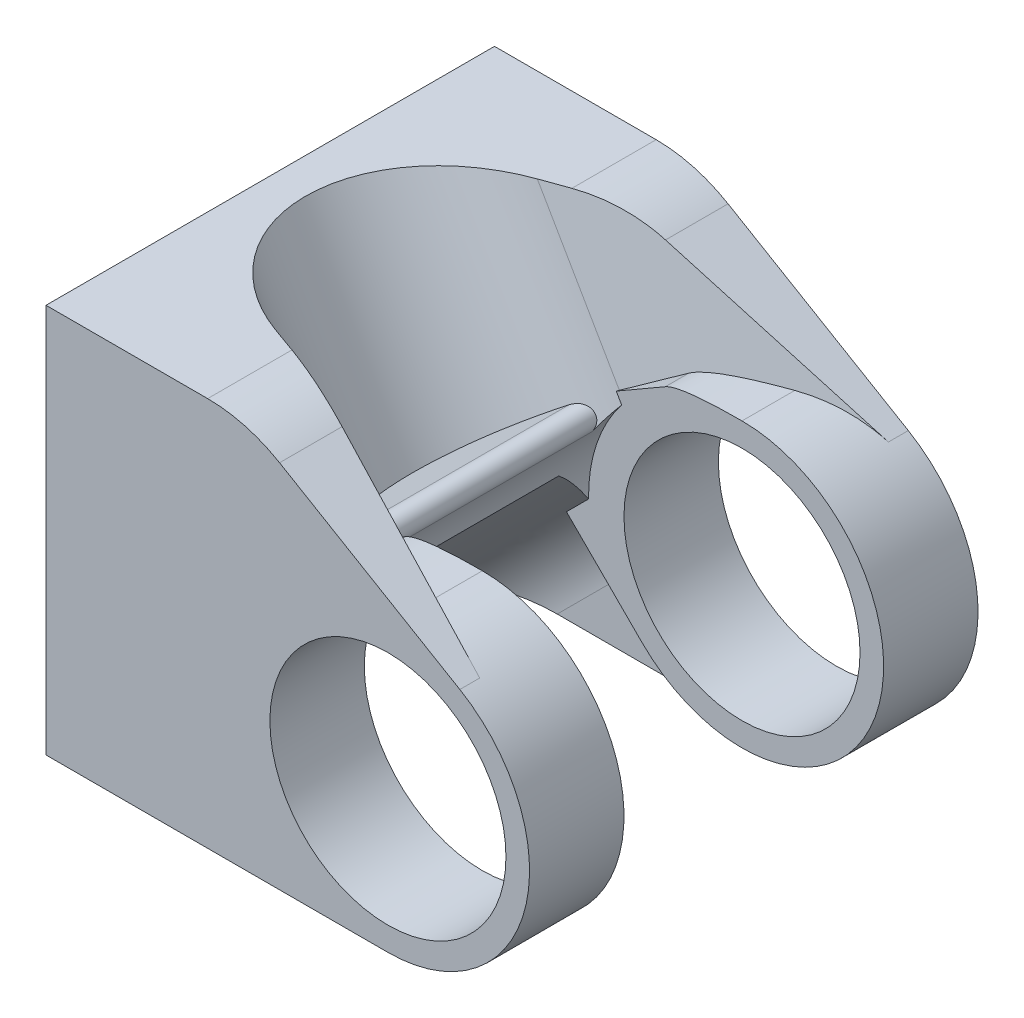
from build123d import *

# Parameters (mm, degrees)
EXTRUDE_1_DEPTH          = 9.5
CUT_EXTRUDE_1_DEPTH      = 19.754173631
CUT_EXTRUDE_1_DEPTH_BACK = 19.754173631
CUT_EXTRUDE_3_DEPTH      = 18.322626143
CUT_EXTRUDE_3_DEPTH_BACK = 18.322626143
SKETCH_5_R               = 6.5
CUT_EXTRUDE_4_DEPTH      = 6.5
EXTRUDE_2_DEPTH          = 6.5
EXTRUDE_START            = -3
EXTRUDE_3_DEPTH          = 4
CUT_EXTRUDE_5_DEPTH      = 21.256440541
CUT_EXTRUDE_5_DEPTH_BACK = 21.256440541
SKETCH_10_R              = 5
FILLET_1_R               = 6


with BuildPart() as part:
    # Эскиз2 → Бобышка-Вытянуть1 (new, symmetric)
    with BuildSketch(Plane.XY):
        with BuildLine():
            Line((3.046153846, 5.169230769), (-6, 10.5))
            Line((-6, 10.5), (-14.485281374, 10.5))
            Line((-14.485281374, 10.5), (-14.485281374, -6))
            Line((-14.485281374, -6), (0, -6))
            ThreePointArc((0, -6), (5.788582927, -1.578704435), (3.046153846, 5.169230769))
        make_face()
    extrude(amount=EXTRUDE_1_DEPTH, both=True)

    # Эскиз3 → Вырез-Вытянуть1 (cut, two sides: drawn at the far end of the back side and taken through both)
    with BuildSketch(Plane(origin=(-3.249999973, 5.629165078, 0), x_dir=(0.8660254037844386, 0.4999999999999999, 0), z_dir=(-0.49999999999999994, 0.8660254037844387, 0)).offset(-CUT_EXTRUDE_1_DEPTH_BACK)):
        with BuildLine():
            Line((6, -8.979634576), (6, 8.979634576))
            Line((6, 8.979634576), (-2.296100594, 5.543277195))
            ThreePointArc((-2.296100594, 5.543277195), (-6, 0), (-2.296100594, -5.543277195))
            Line((-2.296100594, -5.543277195), (6, -8.979634576))
        make_face()
    extrude(amount=CUT_EXTRUDE_1_DEPTH + CUT_EXTRUDE_1_DEPTH_BACK, mode=Mode.SUBTRACT)

    # Эскиз4 → Вырез-Вытянуть3 (cut, two sides: drawn at the far end of the back side and taken through both)
    with BuildSketch(Plane(origin=(-4.242640687, 4.242640687, 0), x_dir=(-0.7071067811865511, 0.707106781186544, 0), z_dir=(-0.707106781186544, -0.7071067811865511, 0)).offset(-CUT_EXTRUDE_3_DEPTH_BACK)):
        with BuildLine():
            Line((-12, -6.5), (-4, -6.5))
            add(Edge.make_bspline(
                [(-4, -6.5), (0, -6.5), (0, -2)],
                knots=[0, 0, 0, 1.570796327, 1.570796327, 1.570796327], degree=2, weights=[1, 0.707106781, 1]))
            Line((0, -2), (0, 2))
            add(Edge.make_bspline(
                [(0, 2), (0, 6.5), (-4, 6.5)],
                knots=[4.71238898, 4.71238898, 4.71238898, 6.283185307, 6.283185307, 6.283185307], degree=2, weights=[1, 0.707106781, 1]))
            Line((-4, 6.5), (-12, 6.5))
            Line((-12, 6.5), (-12, -6.5))
        make_face()
    extrude(amount=CUT_EXTRUDE_3_DEPTH + CUT_EXTRUDE_3_DEPTH_BACK, mode=Mode.SUBTRACT)

    # Эскиз5 → Вырез-Вытянуть4 (cut, symmetric)
    with BuildSketch(Plane.XY):
        Circle(SKETCH_5_R)
    extrude(amount=CUT_EXTRUDE_4_DEPTH, both=True, mode=Mode.SUBTRACT)

    # Эскиз6 → Бобышка-Вытянуть2 (add, symmetric)
    with BuildSketch(Plane.XY):
        with BuildLine():
            Line((-6.502520338, 3.75132157), (-8.445640507, 2.629460617))
            Line((-8.445640507, 2.629460617), (-8.980852778, -0.495571404))
            ThreePointArc((-8.980852778, -0.495571404), (-7.713770339, 0.615313333), (-6.312263919, 1.550910769))
            ThreePointArc((-6.312263919, 1.550910769), (-6.076847823, 2.306928809), (-5.751252167, 3.028712353))
            ThreePointArc((-5.751252167, 3.028712353), (-5.855186593, 3.672492332), (-6.502520338, 3.75132157))
        make_face()
    extrude(amount=EXTRUDE_2_DEPTH, both=True)

    # Эскиз9 → Бобышка-Вытянуть3 (add)
    with BuildSketch(Plane(origin=(0, 0, 6.5), x_dir=(-1, 0, 0), z_dir=(0, 0, -1)).offset(EXTRUDE_START)):
        with BuildLine():
            Line((4.242640687, -4.242640687), (10.137783082, 1.652501708))
            Line((10.137783082, 1.652501708), (3.25, 5.629165125))
            add(Edge.make_bspline(
                [(3.25, 5.629165125), (2.607695155, 6), (0, 6)],
                knots=[0, 0, 0, 1, 1, 1], degree=2))
            ThreePointArc((0, 6), (-5.543277195, -2.296100594), (4.242640687, -4.242640687))
        make_face()
    extrude_3 = extrude(amount=EXTRUDE_3_DEPTH)

    # Зеркальное отражение1: Бобышка-Вытянуть3 across plane
    add(extrude_3.mirror(Plane.XY))

    # Эскиз10 → Вырез-Вытянуть5 (cut, two sides: drawn at the far end of the back side and taken through both)
    with BuildSketch(Plane.XY.offset(-CUT_EXTRUDE_5_DEPTH_BACK)):
        Circle(SKETCH_10_R)
    extrude(amount=CUT_EXTRUDE_5_DEPTH + CUT_EXTRUDE_5_DEPTH_BACK, mode=Mode.SUBTRACT)

    # Скругление1
    fillet_1_edges = [part.edges().sort_by_distance(p)[0] for p in [
        (-6, 10.5, 8.008328799),
        (-6, 10.5, -8.008328799),
    ]]
    fillet(fillet_1_edges, radius=FILLET_1_R)


solid = part.part
